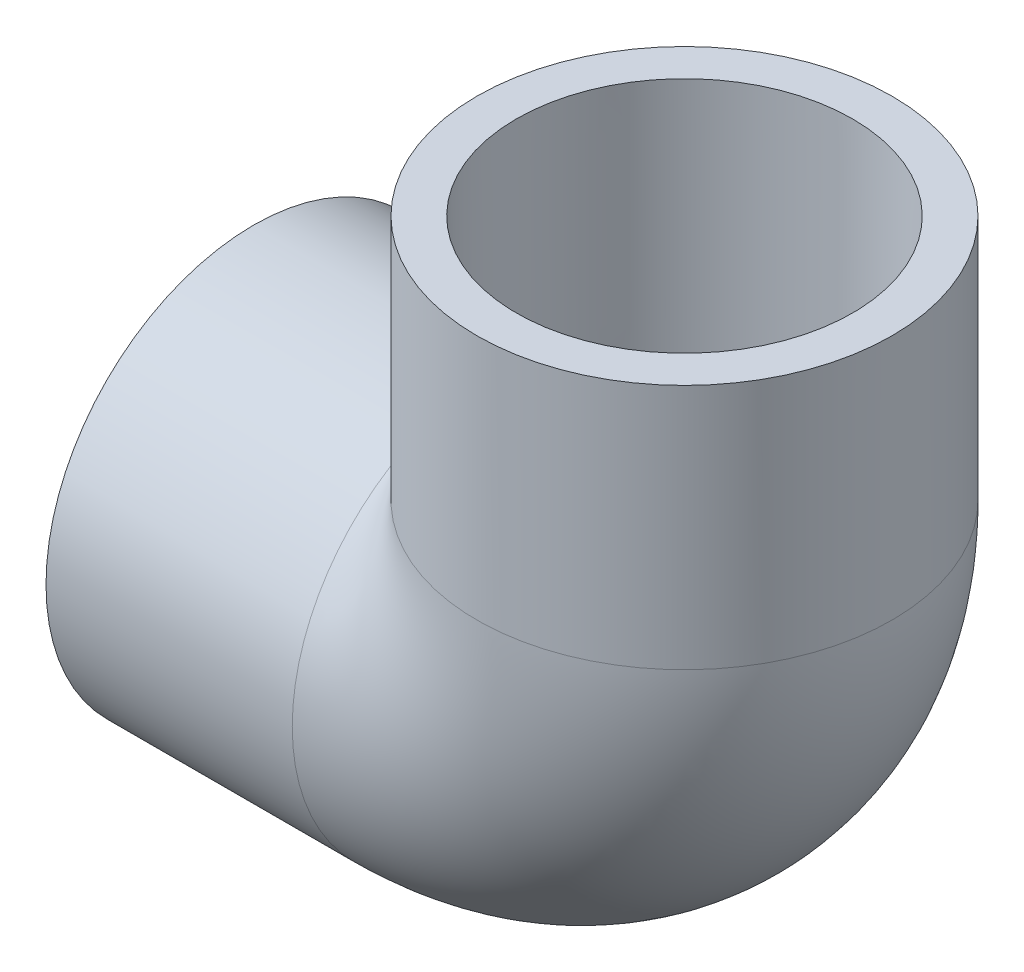
from build123d import *

# Parameters (mm, degrees)
SKETCH3_R    = 29.972
SKETCH3_R_2  = 19.05
SCALE1_SCALE = 0.865


with BuildPart() as part:
    # Sketch1 → Revolve1 (revolve)
    with BuildSketch(Plane.XY):
        Polygon((-62.23, -29.972), (-26.67, -29.972), (-26.67, -24.0538), (-62.23, -24.2824), align=None)
    revolve(axis=Axis((-62.23, 0, 0), (1, 0, 0)))


with BuildPart() as body_2:
    # Sketch2 → Revolve2 (revolve)
    with BuildSketch(Plane.XY):
        Polygon((24.2824, 62.23), (24.0538, 26.67), (29.972, 26.67), (29.972, 62.23), align=None)
    revolve(axis=Axis((0, 0, 0), (0, 1, 0)))


with BuildPart() as sweep1_tool:
    # Sweep1: sweep along a path in Sketch4
    with BuildLine(Plane.XY) as sweep1_path:
        ThreePointArc((-26.67, 0), (-7.811462, 7.811462), (0, 26.67))
    # Sketch3 → Sweep1 (sweep)
    with BuildSketch(Plane(origin=(-26.67, 0, 0), x_dir=(0, 0, -1), z_dir=(1, 0, 0))):
        Circle(SKETCH3_R)
        Circle(SKETCH3_R_2, mode=Mode.SUBTRACT)
    sweep(path=sweep1_path.line)


with BuildPart() as part_1:
    add(part.part)


with BuildPart() as part_2:
    # Sweep1: joined with sweep1_tool
    add(part_1.part.fuse(sweep1_tool.part, body_2.part, tol=0.00001))


with BuildPart() as part_3:
    # Scale1: scaled about (0, 0, 0)
    add(part_2.part.scale(SCALE1_SCALE))


solid = part_3.part
